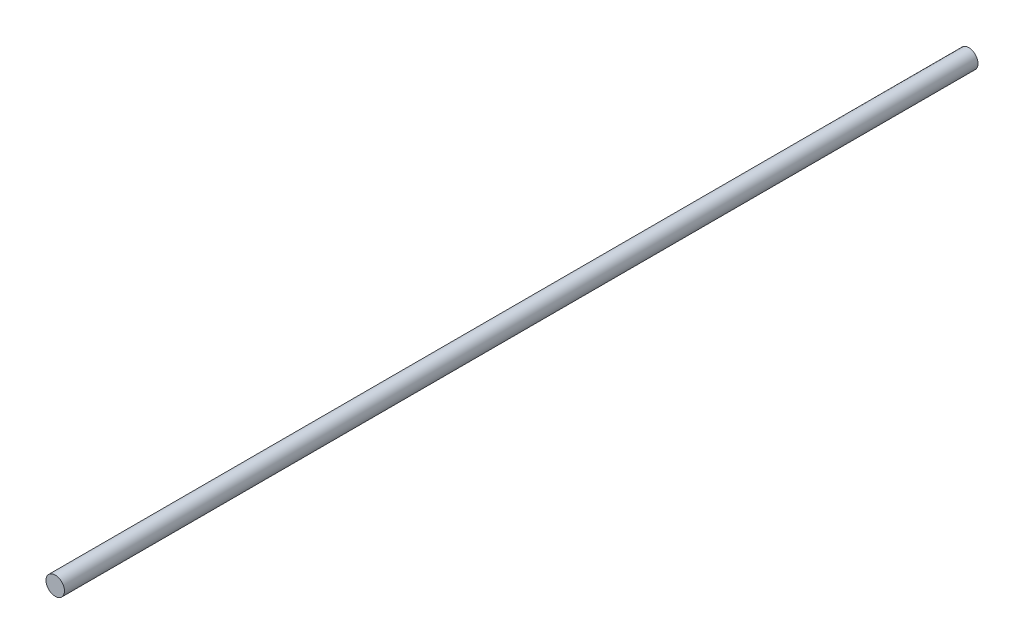
from build123d import *

# Parameters (mm, degrees)
SKETCH2_W = 395
SKETCH2_H = 4


with BuildPart() as part:
    # Sketch2 → Revolve1 (revolve)
    with BuildSketch(Plane(origin=(0, 0, 0), x_dir=(0, 0, -1), z_dir=(1, 0, 0))):
        with Locations((197.5, 2)):
            Rectangle(SKETCH2_W, SKETCH2_H)
    revolve(axis=Axis((0, 0, 0), (0, 0, -1)))


solid = part.part
